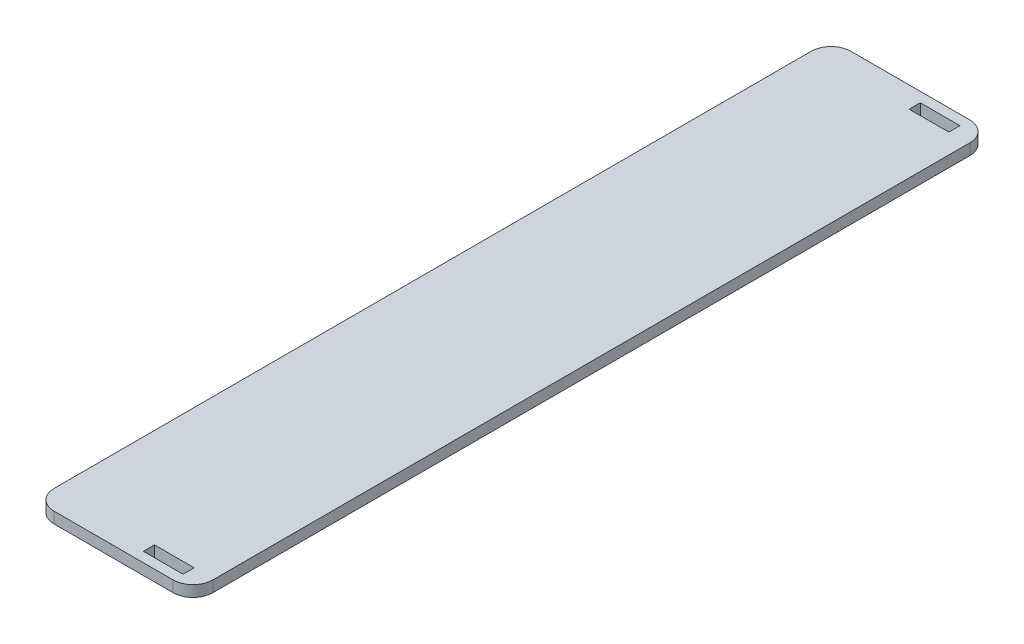
from build123d import *

# Parameters (mm, degrees)
SKETCH_1_W      = 20
SKETCH_1_H      = 5.6
EXTRUDE_1_DEPTH = 5.6
FILLET_1_R      = 10


with BuildPart() as part:
    # ｽｹｯﾁ1 → ﾎﾞｽ - 押し出し1 (new body)
    with BuildSketch(Plane(origin=(0, 0, 0), x_dir=(1, 0, 0), z_dir=(0, 1, 0))):
        Polygon((-20, 200.9), (20, 200.9), (20, -200.9), (-20, -200.9), (-60, -200.9), (-60, 200.9), align=None)
        with Locations((0, -193.1)):
            Rectangle(SKETCH_1_W, SKETCH_1_H, mode=Mode.SUBTRACT)
        with Locations((0, 193.1)):
            Rectangle(SKETCH_1_W, SKETCH_1_H, mode=Mode.SUBTRACT)
    extrude(amount=EXTRUDE_1_DEPTH)

    # ﾌｨﾚｯﾄ1
    fillet_1_edges = [part.edges().sort_by_distance(p)[0] for p in [
        (20, 2.8, -200.9),
        (20, 2.8, 200.9),
        (-60, 2.8, -200.9),
        (-60, 2.8, 200.9),
    ]]
    fillet(fillet_1_edges, radius=FILLET_1_R)


solid = part.part
